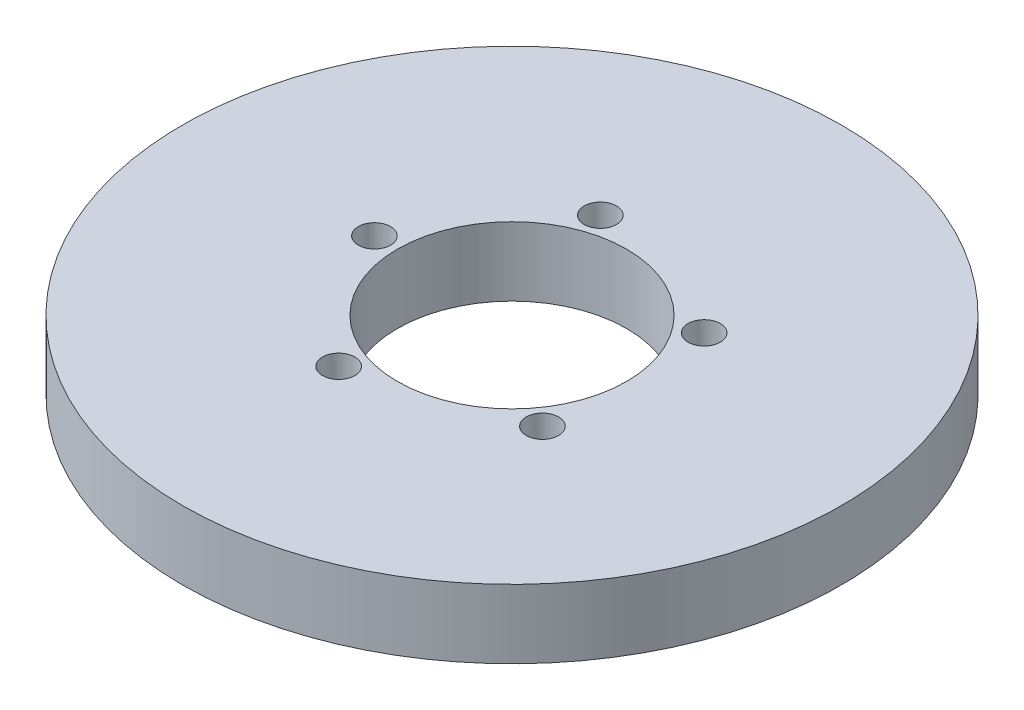
from build123d import *

# Parameters (mm, degrees)
SKETCH1_R           = 57.5
BOSS_EXTRUDE1_DEPTH = 12
SKETCH2_R           = 20
CUT_EXTRUDE1_DEPTH  = 83.197931847
SKETCH3_R           = 2.817645385
CUT_EXTRUDE2_DEPTH  = 10.793993775
CIRPATTERN1_COUNT   = 5


with BuildPart() as part:
    # Sketch1 → Boss-Extrude1 (new body)
    with BuildSketch(Plane(origin=(0, 0, 0), x_dir=(1, 0, 0), z_dir=(0, 1, 0))):
        Circle(SKETCH1_R)
    extrude(amount=BOSS_EXTRUDE1_DEPTH)

    # Sketch2 → Cut-Extrude1 (cut, through all)
    with BuildSketch(Plane(origin=(0, 0, 0), x_dir=(1, 0, 0), z_dir=(0, 1, 0))):
        Circle(SKETCH2_R)
    extrude(amount=CUT_EXTRUDE1_DEPTH, mode=Mode.SUBTRACT)

    # Sketch3 → Cut-Extrude2 (cut)
    with BuildSketch(Plane(origin=(0, 12, 0), x_dir=(1, 0, 0), z_dir=(0, 1, 0))):
        with Locations((-24.002856674, 0)):
            Circle(SKETCH3_R)
    cut_extrude2 = extrude(amount=-CUT_EXTRUDE2_DEPTH, mode=Mode.SUBTRACT)

    # CirPattern1: Cut-Extrude2 ×5 about axis
    cirpattern1_axis = Axis((0, 0, 0), (0, 1, 0))
    for i in range(1, CIRPATTERN1_COUNT):
        add(cut_extrude2.rotate(cirpattern1_axis, i * 360 / CIRPATTERN1_COUNT), mode=Mode.SUBTRACT)


solid = part.part
